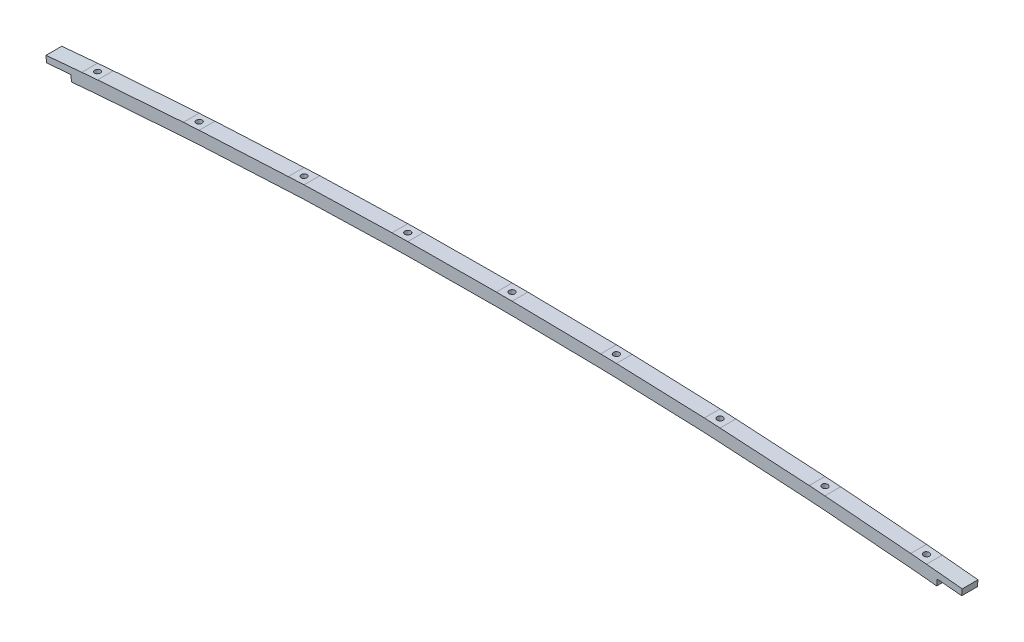
from build123d import *

# Parameters (mm, degrees)
BOSS_EXTRUDE1_DEPTH = 4.7625
SKETCH2_R           = 3.048
CUT_EXTRUDE1_DEPTH  = 3.556
SKETCH3_R           = 1.778
CUT_EXTRUDE2_DEPTH  = 277.706047268
SKETCH4_R           = 3.048
CUT_EXTRUDE3_DEPTH  = 3.556
SKETCH5_R           = 3.048
CUT_EXTRUDE4_DEPTH  = 3.556
SKETCH6_R           = 3.048
CUT_EXTRUDE5_DEPTH  = 3.556
SKETCH7_R           = 3.048
CUT_EXTRUDE6_DEPTH  = 3.556
SKETCH8_R           = 1.778
CUT_EXTRUDE7_DEPTH  = 273.722762612
SKETCH9_R           = 1.778
CUT_EXTRUDE8_DEPTH  = 274.775889667
SKETCH10_R          = 1.778
CUT_EXTRUDE9_DEPTH  = 276.233622552
SKETCH11_R          = 1.778
CUT_EXTRUDE10_DEPTH = 276.83087619


with BuildPart() as part:
    # Sketch1 → Boss-Extrude1 (new, symmetric)
    with BuildSketch(Plane(origin=(0, 0, 4.097149242), x_dir=(-1, 0, 0), z_dir=(0, 0, -1))):
        Polygon((0.250661746, -50.653885537), (5.013117184, -50.633283353), (4.98015369, -43.013354652), (0.217698252, -43.033956836), (-53.294657701, -43.852653014), (-62.816371972, -44.102817558), (-115.983026964, -46.037003418), (-125.492633629, -46.578303782), (-179.358518215, -49.726692243), (-188.860077886, -50.394516158), (-240.748610926, -54.601095566), (-250.233747084, -55.471622439), (-271.864542794, -57.577031547), (-271.511576408, -61.370646542), (-256.780990146, -60.000079995), (-256.417466381, -63.773158253), (-249.537325585, -63.059731366), (-240.052189426, -62.189204494), (-188.325818753, -57.995763897), (-178.824259081, -57.327939981), (-125.059593338, -54.185989113), (-115.549986674, -53.64468875), (-62.616240336, -51.720188977), (-53.094526063, -51.470024432), align=None)
    boss_extrude1 = extrude(amount=BOSS_EXTRUDE1_DEPTH, both=True)

    # Sketch2 → Cut-Extrude1 (cut)
    with BuildSketch(Plane(origin=(-3.654807803, -39.822262509, 0), x_dir=(0.995814819891653, -0.09139389741199735, 0), z_dir=(-0.09139389741199735, -0.995814819891653, 0))):
        with Locations((249.493741553, 4.097149242)):
            Circle(SKETCH2_R)
    cut_extrude1 = extrude(amount=-CUT_EXTRUDE1_DEPTH, mode=Mode.SUBTRACT)

    # Sketch3 → Cut-Extrude2 (cut, through all)
    with BuildSketch(Plane(origin=(-3.329811104, -36.28114501, 0), x_dir=(0.995814819891653, -0.09139389741199735, 0), z_dir=(-0.09139389741199735, -0.995814819891653, 0))):
        with Locations((249.493741553, 4.097149242)):
            Circle(SKETCH3_R)
    cut_extrude2 = extrude(amount=-CUT_EXTRUDE2_DEPTH, mode=Mode.SUBTRACT)

    # Sketch4 → Cut-Extrude3 (cut)
    with BuildSketch(Plane(origin=(-3.130464047, -44.539122171, 0), x_dir=(0.9975390732743608, -0.07011274699317857, 0), z_dir=(-0.07011274699317857, -0.9975390732743608, 0))):
        with Locations((187.166105034, 4.097149242)):
            Circle(SKETCH4_R)
    cut_extrude3 = extrude(amount=-CUT_EXTRUDE3_DEPTH, mode=Mode.SUBTRACT)

    # Sketch5 → Cut-Extrude4 (cut)
    with BuildSketch(Plane(origin=(-2.670492031, -46.915410629, 0), x_dir=(-0.998383901802788, 0.05682943445997907, 0), z_dir=(-0.05682943445997907, -0.9983839018027881, 0))):
        with Locations((-123.174343872, -4.097149242)):
            Circle(SKETCH5_R)
    cut_extrude4 = extrude(amount=-CUT_EXTRUDE4_DEPTH, mode=Mode.SUBTRACT)

    # Sketch6 → Cut-Extrude5 (cut)
    with BuildSketch(Plane(origin=(-1.314717641, -50.040527253, 0), x_dir=(0.9996550418058789, -0.02626399421425536, 0), z_dir=(-0.02626399421425536, -0.9996550418058789, 0))):
        with Locations((59.190519095, 4.097149242)):
            Circle(SKETCH6_R)
    cut_extrude5 = extrude(amount=-CUT_EXTRUDE5_DEPTH, mode=Mode.SUBTRACT)

    # Sketch7 → Cut-Extrude6 (cut)
    with BuildSketch(Plane(origin=(-0.219127188, -50.654021954, 0), x_dir=(-0.9999906431736124, 0.004325917847692405, 0), z_dir=(-0.004325917847692405, -0.9999906431736125, 0))):
        with Locations((4.794034853, -4.097149242)):
            Circle(SKETCH7_R)
    cut_extrude6 = extrude(amount=-CUT_EXTRUDE6_DEPTH, mode=Mode.SUBTRACT)

    # Sketch8 → Cut-Extrude7 (cut, through all)
    with BuildSketch(Plane(origin=(-0.203744224, -47.098055227, 0), x_dir=(0.9999906431736124, -0.004325917847692406, 0), z_dir=(-0.004325917847692406, -0.9999906431736125, 0))):
        with Locations((-4.794034853, 4.097149242)):
            Circle(SKETCH8_R)
    cut_extrude7 = extrude(amount=-CUT_EXTRUDE7_DEPTH, mode=Mode.SUBTRACT)

    # Sketch9 → Cut-Extrude8 (cut, through all)
    with BuildSketch(Plane(origin=(-1.221322877, -46.485753925, 0), x_dir=(0.9996550418058789, -0.02626399421425536, 0), z_dir=(-0.02626399421425536, -0.9996550418058789, 0))):
        with Locations((59.190519095, 4.097149242)):
            Circle(SKETCH9_R)
    cut_extrude8 = extrude(amount=-CUT_EXTRUDE8_DEPTH, mode=Mode.SUBTRACT)

    # Sketch10 → Cut-Extrude9 (cut, through all)
    with BuildSketch(Plane(origin=(-2.468406562, -43.365157475, 0), x_dir=(0.998383901802788, -0.05682943445997909, 0), z_dir=(-0.05682943445997909, -0.9983839018027881, 0))):
        with Locations((123.174343872, 4.097149242)):
            Circle(SKETCH10_R)
    cut_extrude9 = extrude(amount=-CUT_EXTRUDE9_DEPTH, mode=Mode.SUBTRACT)

    # Sketch11 → Cut-Extrude10 (cut, through all)
    with BuildSketch(Plane(origin=(-2.881143118, -40.991873227, 0), x_dir=(-0.9975390732743608, 0.07011274699317857, 0), z_dir=(-0.07011274699317857, -0.9975390732743608, 0))):
        with Locations((-187.166105034, -4.097149242)):
            Circle(SKETCH11_R)
    cut_extrude10 = extrude(amount=-CUT_EXTRUDE10_DEPTH, mode=Mode.SUBTRACT)

    # Mirror1: Boss-Extrude1, Cut-Extrude1, Cut-Extrude2, Cut-Extrude3, Cut-Extrude4, Cut-Extrude5, Cut-Extrude6, Cut-Extrude7, Cut-Extrude8, Cut-Extrude9, Cut-Extrude10 across plane
    add(boss_extrude1.mirror(Plane(origin=(-4.793989996, 0.020738601, 8.859649242), x_dir=(0, 0, 1), z_dir=(-0.9999906431736159, 0.004325917846891031, 0))))
    add(cut_extrude1.mirror(Plane(origin=(-4.793989996, 0.020738601, 8.859649242), x_dir=(0, 0, 1), z_dir=(-0.9999906431736159, 0.004325917846891031, 0))), mode=Mode.SUBTRACT)
    add(cut_extrude2.mirror(Plane(origin=(-4.793989996, 0.020738601, 8.859649242), x_dir=(0, 0, 1), z_dir=(-0.9999906431736159, 0.004325917846891031, 0))), mode=Mode.SUBTRACT)
    add(cut_extrude3.mirror(Plane(origin=(-4.793989996, 0.020738601, 8.859649242), x_dir=(0, 0, 1), z_dir=(-0.9999906431736159, 0.004325917846891031, 0))), mode=Mode.SUBTRACT)
    add(cut_extrude4.mirror(Plane(origin=(-4.793989996, 0.020738601, 8.859649242), x_dir=(0, 0, 1), z_dir=(-0.9999906431736159, 0.004325917846891031, 0))), mode=Mode.SUBTRACT)
    add(cut_extrude5.mirror(Plane(origin=(-4.793989996, 0.020738601, 8.859649242), x_dir=(0, 0, 1), z_dir=(-0.9999906431736159, 0.004325917846891031, 0))), mode=Mode.SUBTRACT)
    add(cut_extrude6.mirror(Plane(origin=(-4.793989996, 0.020738601, 8.859649242), x_dir=(0, 0, 1), z_dir=(-0.9999906431736159, 0.004325917846891031, 0))), mode=Mode.SUBTRACT)
    add(cut_extrude7.mirror(Plane(origin=(-4.793989996, 0.020738601, 8.859649242), x_dir=(0, 0, 1), z_dir=(-0.9999906431736159, 0.004325917846891031, 0))), mode=Mode.SUBTRACT)
    add(cut_extrude8.mirror(Plane(origin=(-4.793989996, 0.020738601, 8.859649242), x_dir=(0, 0, 1), z_dir=(-0.9999906431736159, 0.004325917846891031, 0))), mode=Mode.SUBTRACT)
    add(cut_extrude9.mirror(Plane(origin=(-4.793989996, 0.020738601, 8.859649242), x_dir=(0, 0, 1), z_dir=(-0.9999906431736159, 0.004325917846891031, 0))), mode=Mode.SUBTRACT)
    add(cut_extrude10.mirror(Plane(origin=(-4.793989996, 0.020738601, 8.859649242), x_dir=(0, 0, 1), z_dir=(-0.9999906431736159, 0.004325917846891031, 0))), mode=Mode.SUBTRACT)


solid = part.part
